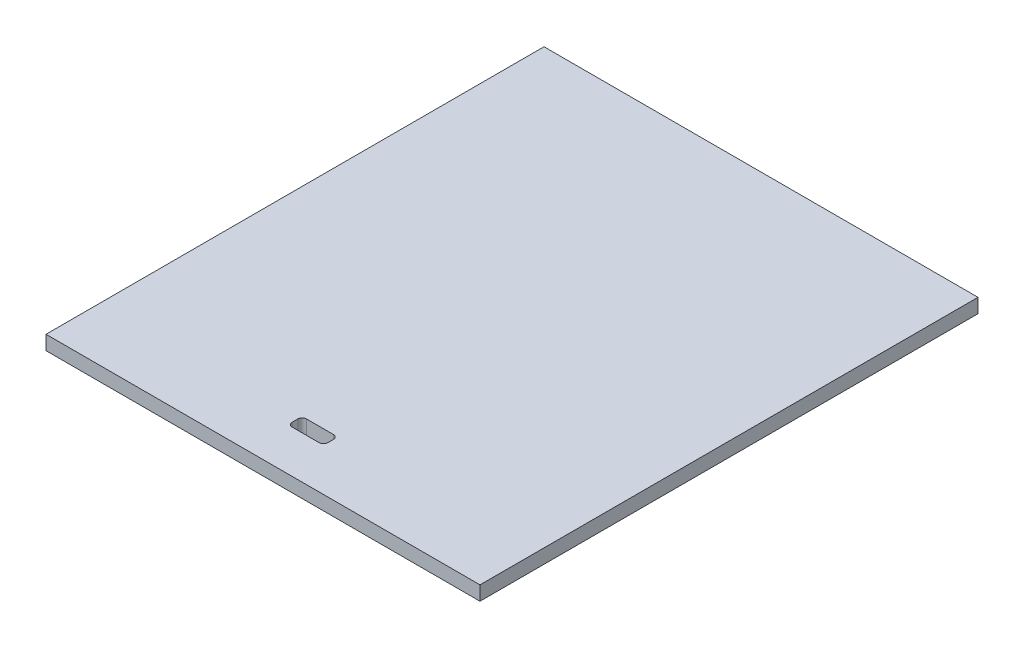
from build123d import *

# Parameters (mm, degrees)
EXTRUDE_1_DEPTH     = 20
CUT_EXTRUDE_1_DEPTH = 20


with BuildPart() as part:
    # 草图1 → 凸台-拉伸1 (new body)
    with BuildSketch(Plane(origin=(0, 0, 0), x_dir=(1, 0, 0), z_dir=(0, 1, 0))):
        Polygon((610, 0), (610, 230), (610, 700), (0, 700), (0, 0), align=None)
    extrude(amount=EXTRUDE_1_DEPTH)

    # 草图2 → 切除-拉伸1 (cut)
    with BuildSketch(Plane(origin=(0, 20, 0), x_dir=(1, 0, 0), z_dir=(0, 1, 0))):
        with BuildLine():
            Line((286, 80), (324, 80))
            ThreePointArc((324, 80), (328.242640687, 78.242640687), (330, 74))
            Line((330, 74), (330, 66))
            ThreePointArc((330, 66), (328.242640687, 61.757359313), (324, 60))
            Line((324, 60), (286, 60))
            ThreePointArc((286, 60), (281.757359313, 61.757359313), (280, 66))
            Line((280, 66), (280, 74))
            ThreePointArc((280, 74), (281.757359313, 78.242640687), (286, 80))
        make_face()
    extrude(amount=-CUT_EXTRUDE_1_DEPTH, mode=Mode.SUBTRACT)


solid = part.part
